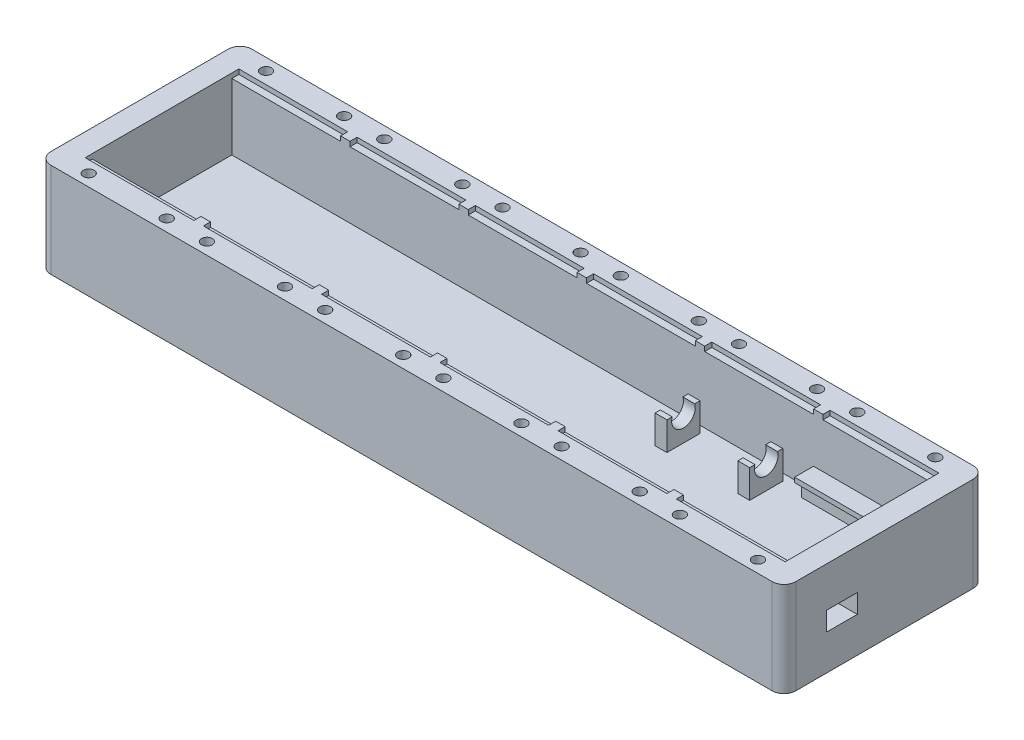
from build123d import *

# Parameters (mm, degrees)
SKIZZE2_W                       = 315
SKIZZE2_H                       = 40
AUFSATZ_LINEAR_AUSTRAGEN1_DEPTH = 85
SKIZZE4_W                       = 296
SKIZZE4_H                       = 59
SCHNITT_LINEAR_AUSTRAGEN1_DEPTH = 30
SKIZZE11_W                      = 46
SKIZZE11_H                      = 3
SKIZZE11_H_2                    = 3.008661904
SCHNITT_LINEAR_AUSTRAGEN4_DEPTH = 2
SKIZZE17_R                      = 2.3
SCHNITT_LINEAR_AUSTRAGEN6_DEPTH = 4
VERRUNDUNG2_R                   = 5
VERRUNDUNG3_R                   = 5
VERRUNDUNG4_R                   = 5
VERRUNDUNG6_R                   = 5
SKIZZE18_W                      = 13
SKIZZE18_H                      = 8
SCHNITT_LINEAR_AUSTRAGEN7_DEPTH = 10
SKIZZE20_W                      = 5
SKIZZE20_H                      = 14
AUFSATZ_LINEAR_AUSTRAGEN2_DEPTH = 12
SKIZZE21_R                      = 5
SCHNITT_LINEAR_AUSTRAGEN8_DEPTH = 71
SKIZZE22_W                      = 50
SKIZZE22_H                      = 9
AUFSATZ_LINEAR_AUSTRAGEN3_DEPTH = 5
SKIZZE23_W                      = 50
SKIZZE23_H                      = 2
AUFSATZ_LINEAR_AUSTRAGEN4_DEPTH = 3


with BuildPart() as part:
    # Skizze2 → Aufsatz-Linear austragen1 (new body)
    with BuildSketch(Plane.XY):
        with Locations((157.5, 20)):
            Rectangle(SKIZZE2_W, SKIZZE2_H)
    extrude(amount=AUFSATZ_LINEAR_AUSTRAGEN1_DEPTH)

    # Skizze4 → Schnitt-Linear austragen1 (cut)
    with BuildSketch(Plane(origin=(0, 40, 0), x_dir=(1, 0, 0), z_dir=(0, 1, 0))):
        with Locations((157.5, -42.5)):
            Rectangle(SKIZZE4_W, SKIZZE4_H)
    extrude(amount=-SCHNITT_LINEAR_AUSTRAGEN1_DEPTH, mode=Mode.SUBTRACT)

    # Skizze11 → Schnitt-Linear austragen4 (cut)
    with BuildSketch(Plane(origin=(0, 40, 0), x_dir=(1, 0, 0), z_dir=(0, 1, 0))):
        with Locations((32.5, -11.5)):
            Rectangle(SKIZZE11_W, SKIZZE11_H)
        with Locations((32.5, -73.5)):
            Rectangle(SKIZZE11_W, SKIZZE11_H)
        with Locations((82.5, -73.5)):
            Rectangle(SKIZZE11_W, SKIZZE11_H)
        with Locations((132.5, -73.504330952)):
            Rectangle(SKIZZE11_W, SKIZZE11_H_2)
        with Locations((182.5, -73.504330952)):
            Rectangle(SKIZZE11_W, SKIZZE11_H_2)
        with Locations((232.5, -73.5)):
            Rectangle(SKIZZE11_W, SKIZZE11_H)
        with Locations((282.5, -73.5)):
            Rectangle(SKIZZE11_W, SKIZZE11_H)
        with Locations((282.5, -11.5)):
            Rectangle(SKIZZE11_W, SKIZZE11_H)
        with Locations((232.5, -11.5)):
            Rectangle(SKIZZE11_W, SKIZZE11_H)
        with Locations((182.5, -11.5)):
            Rectangle(SKIZZE11_W, SKIZZE11_H)
        with Locations((132.5, -11.5)):
            Rectangle(SKIZZE11_W, SKIZZE11_H)
        with Locations((82.5, -11.5)):
            Rectangle(SKIZZE11_W, SKIZZE11_H)
    extrude(amount=-SCHNITT_LINEAR_AUSTRAGEN4_DEPTH, mode=Mode.SUBTRACT)

    # Skizze17 → Schnitt-Linear austragen6 (cut)
    with BuildSketch(Plane(origin=(0, 40, 0), x_dir=(1, 0, 0), z_dir=(0, 1, 0))):
        with Locations((49, -80)):
            Circle(SKIZZE17_R)
        with Locations((16, -80)):
            Circle(SKIZZE17_R)
        with Locations((16, -5)):
            Circle(SKIZZE17_R)
        with Locations((49, -5)):
            Circle(SKIZZE17_R)
        with Locations((66, -5)):
            Circle(SKIZZE17_R)
        with Locations((99, -5)):
            Circle(SKIZZE17_R)
        with Locations((66, -80)):
            Circle(SKIZZE17_R)
        with Locations((99, -80)):
            Circle(SKIZZE17_R)
        with Locations((116, -80)):
            Circle(SKIZZE17_R)
        with Locations((149, -80)):
            Circle(SKIZZE17_R)
        with Locations((166, -80)):
            Circle(SKIZZE17_R)
        with Locations((199, -80)):
            Circle(SKIZZE17_R)
        with Locations((216, -80)):
            Circle(SKIZZE17_R)
        with Locations((249, -80)):
            Circle(SKIZZE17_R)
        with Locations((266, -80)):
            Circle(SKIZZE17_R)
        with Locations((299, -80)):
            Circle(SKIZZE17_R)
        with Locations((299, -5)):
            Circle(SKIZZE17_R)
        with Locations((266, -5)):
            Circle(SKIZZE17_R)
        with Locations((249, -5)):
            Circle(SKIZZE17_R)
        with Locations((216, -5)):
            Circle(SKIZZE17_R)
        with Locations((199, -5)):
            Circle(SKIZZE17_R)
        with Locations((166, -5)):
            Circle(SKIZZE17_R)
        with Locations((149, -5)):
            Circle(SKIZZE17_R)
        with Locations((116, -5)):
            Circle(SKIZZE17_R)
    extrude(amount=-SCHNITT_LINEAR_AUSTRAGEN6_DEPTH, mode=Mode.SUBTRACT)

    # Verrundung2
    verrundung2_edges = [part.edges().sort_by_distance(p)[0] for p in [
        (0, 20, 85),
    ]]
    fillet(verrundung2_edges, radius=VERRUNDUNG2_R)

    # Verrundung3
    verrundung3_edges = [part.edges().sort_by_distance(p)[0] for p in [
        (0, 20, 0),
    ]]
    fillet(verrundung3_edges, radius=VERRUNDUNG3_R)

    # Verrundung4
    verrundung4_edges = [part.edges().sort_by_distance(p)[0] for p in [
        (315, 20, 0),
    ]]
    fillet(verrundung4_edges, radius=VERRUNDUNG4_R)

    # Verrundung6
    verrundung6_edges = [part.edges().sort_by_distance(p)[0] for p in [
        (315, 20, 85),
    ]]
    fillet(verrundung6_edges, radius=VERRUNDUNG6_R)

    # Skizze18 → Schnitt-Linear austragen7 (cut)
    with BuildSketch(Plane.ZY.offset(-305.5)):
        with Locations((60.5, 19)):
            Rectangle(SKIZZE18_W, SKIZZE18_H)
    extrude(amount=-SCHNITT_LINEAR_AUSTRAGEN7_DEPTH, mode=Mode.SUBTRACT)

    # Skizze20 → Aufsatz-Linear austragen2 (add)
    with BuildSketch(Plane(origin=(0, 10, 0), x_dir=(1, 0, 0), z_dir=(0, 1, 0))):
        with Locations((243, -23)):
            Rectangle(SKIZZE20_W, SKIZZE20_H)
        with Locations((208, -23)):
            Rectangle(SKIZZE20_W, SKIZZE20_H)
    extrude(amount=AUFSATZ_LINEAR_AUSTRAGEN2_DEPTH)

    # Skizze21 → Schnitt-Linear austragen8 (cut)
    with BuildSketch(Plane.ZY.offset(-205.5)):
        with Locations((23, 20.5)):
            Circle(SKIZZE21_R)
    extrude(amount=-SCHNITT_LINEAR_AUSTRAGEN8_DEPTH, mode=Mode.SUBTRACT)

    # Skizze22 → Aufsatz-Linear austragen3 (add)
    with BuildSketch(Plane.XY.offset(13)):
        with Locations((280.5, 14.5)):
            Rectangle(SKIZZE22_W, SKIZZE22_H)
    extrude(amount=AUFSATZ_LINEAR_AUSTRAGEN3_DEPTH)

    # Skizze23 → Aufsatz-Linear austragen4 (add)
    with BuildSketch(Plane.XY.offset(18)):
        with Locations((280.5, 18)):
            Rectangle(SKIZZE23_W, SKIZZE23_H)
    extrude(amount=AUFSATZ_LINEAR_AUSTRAGEN4_DEPTH)


solid = part.part
